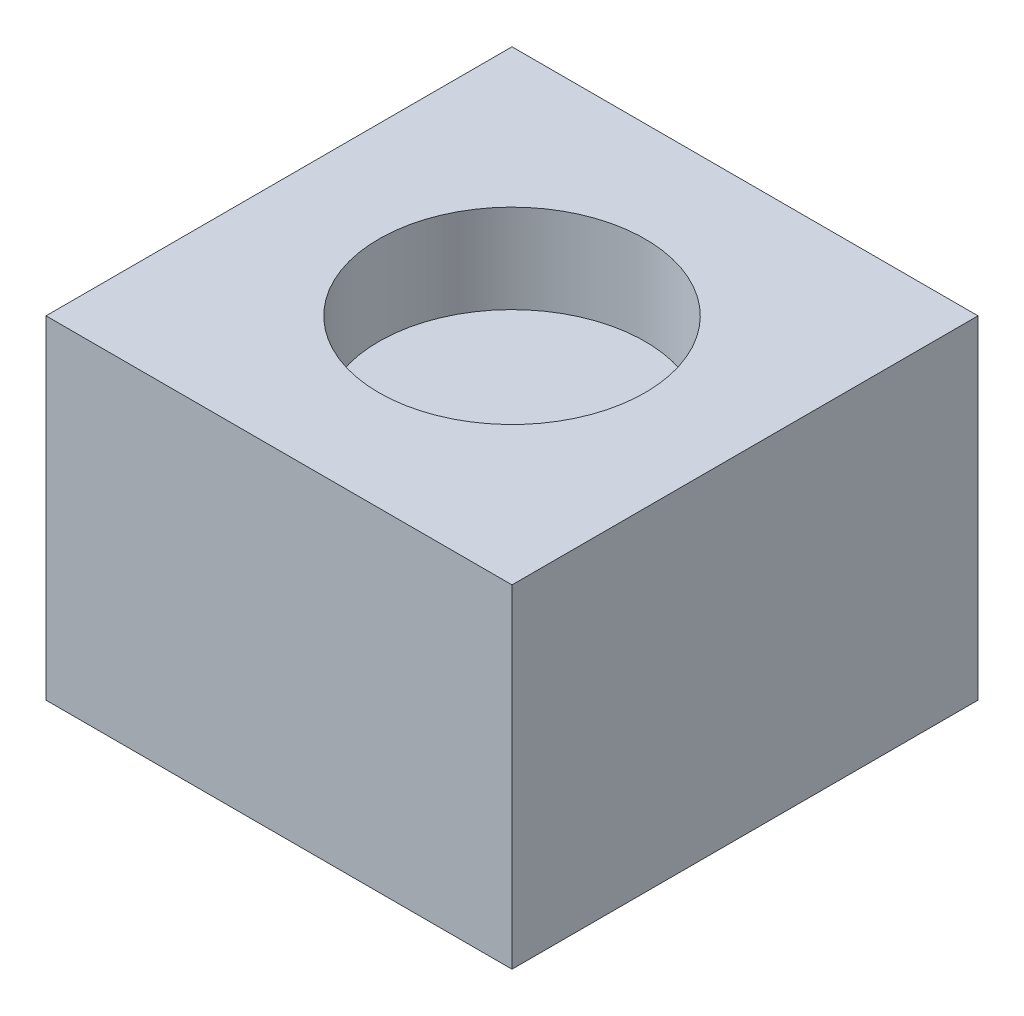
from build123d import *

# Parameters (mm, degrees)
ESQUISSE1_W             = 42
ESQUISSE1_H             = 42
BOSS_EXTRU_1_DEPTH      = 30
ESQUISSE2_R             = 12
ENL_V_MAT_EXTRU_1_DEPTH = 8


with BuildPart() as part:
    # Esquisse1 → Boss.-Extru.1 (new body)
    with BuildSketch(Plane(origin=(0, 0, 0), x_dir=(1, 0, 0), z_dir=(0, 1, 0))):
        Rectangle(ESQUISSE1_W, ESQUISSE1_H)
    extrude(amount=BOSS_EXTRU_1_DEPTH)

    # Esquisse2 → Enlèv. mat.-Extru.1 (cut)
    with BuildSketch(Plane(origin=(0, 30, 0), x_dir=(1, 0, 0), z_dir=(0, 1, 0))):
        Circle(ESQUISSE2_R)
    extrude(amount=-ENL_V_MAT_EXTRU_1_DEPTH, mode=Mode.SUBTRACT)


solid = part.part
